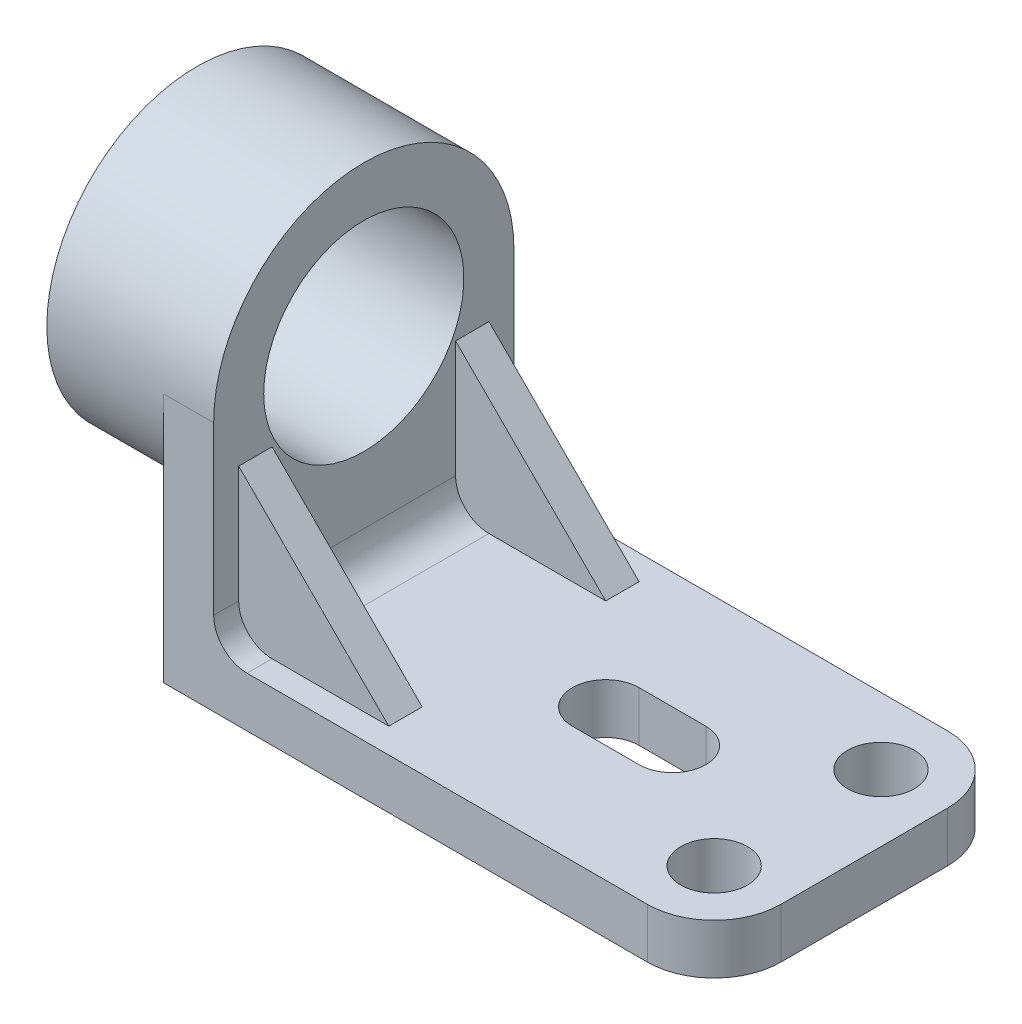
from build123d import *
from build123d.topology import SkipClean

# Parameters (mm, degrees)
SKETCH1_R           = 4
BOSS_EXTRUDE1_DEPTH = 6
SKETCH2_R           = 12
BOSS_EXTRUDE2_DEPTH = 6
SKETCH3_R           = 18
SKETCH3_R_2         = 12
BOSS_EXTRUDE3_DEPTH = 14
FILLET1_R           = 4
BOSS_EXTRUDE4_START = -4
BOSS_EXTRUDE4_DEPTH = 4


with BuildPart() as part:
    # Sketch1 → Boss-Extrude1 (new body)
    with BuildSketch(Plane(origin=(0, 0, 0), x_dir=(1, 0, 0), z_dir=(0, 1, 0))):
        with BuildLine():
            Line((-30, 18), (22, 18))
            ThreePointArc((22, 18), (27.656854249, 15.656854249), (30, 10))
            Line((30, 10), (30, -10))
            ThreePointArc((30, -10), (27.656854249, -15.656854249), (22, -18))
            Line((22, -18), (-30, -18))
            Line((-30, -18), (-30, 18))
        make_face()
        with Locations((22, -10)):
            Circle(SKETCH1_R, mode=Mode.SUBTRACT)
        with Locations((22, 10)):
            Circle(SKETCH1_R, mode=Mode.SUBTRACT)
        with BuildLine():
            Line((-1, 4), (7, 4))
            ThreePointArc((7, 4), (11, 0), (7, -4))
            Line((7, -4), (-1, -4))
            ThreePointArc((-1, -4), (-5, 0), (-1, 4))
        make_face(mode=Mode.SUBTRACT)
    extrude(amount=BOSS_EXTRUDE1_DEPTH)

    # Sketch2 → Boss-Extrude2 (add)
    with BuildSketch(Plane.ZY.offset(30)):
        with BuildLine():
            Line((-18, 0), (-18, 30))
            ThreePointArc((-18, 30), (0, 48), (18, 30))
            Line((18, 30), (18, 0))
            Line((18, 0), (-18, 0))
        make_face()
        with Locations((0, 30)):
            Circle(SKETCH2_R, mode=Mode.SUBTRACT)
    extrude(amount=BOSS_EXTRUDE2_DEPTH)

    # Sketch3 → Boss-Extrude3 (add)
    with SkipClean():  # the faces are left unmerged after this step: merging them gives an invalid solid
        with BuildSketch(Plane.ZY.offset(36)):
            with Locations((0, 30)):
                Circle(SKETCH3_R)
            with Locations((0, 30)):
                Circle(SKETCH3_R_2, mode=Mode.SUBTRACT)
        extrude(amount=BOSS_EXTRUDE3_DEPTH)
    add(part.part.scale(1), mode=Mode.REPLACE)  # the faces are merged on a copy

    # Fillet1
    fillet1_edges = [part.edges().sort_by_distance(p)[0] for p in [
        (-30, 6, 0),
    ]]
    fillet(fillet1_edges, radius=FILLET1_R)

    # Sketch4 → Boss-Extrude4 (add)
    with BuildSketch(Plane.XY.offset(15).offset(BOSS_EXTRUDE4_START)):
        with BuildLine():
            Line((-26, 6), (-12, 6))
            Line((-12, 6), (-30, 24))
            Line((-30, 24), (-30, 10))
            ThreePointArc((-30, 10), (-28.828427125, 7.171572875), (-26, 6))
        make_face()
    boss_extrude4 = extrude(amount=BOSS_EXTRUDE4_DEPTH)

    # Mirror1: Boss-Extrude4 across plane
    add(boss_extrude4.mirror(Plane(origin=(0, 0, 0), x_dir=(1, 0, 0), z_dir=(0, 0, -1))))


solid = part.part
